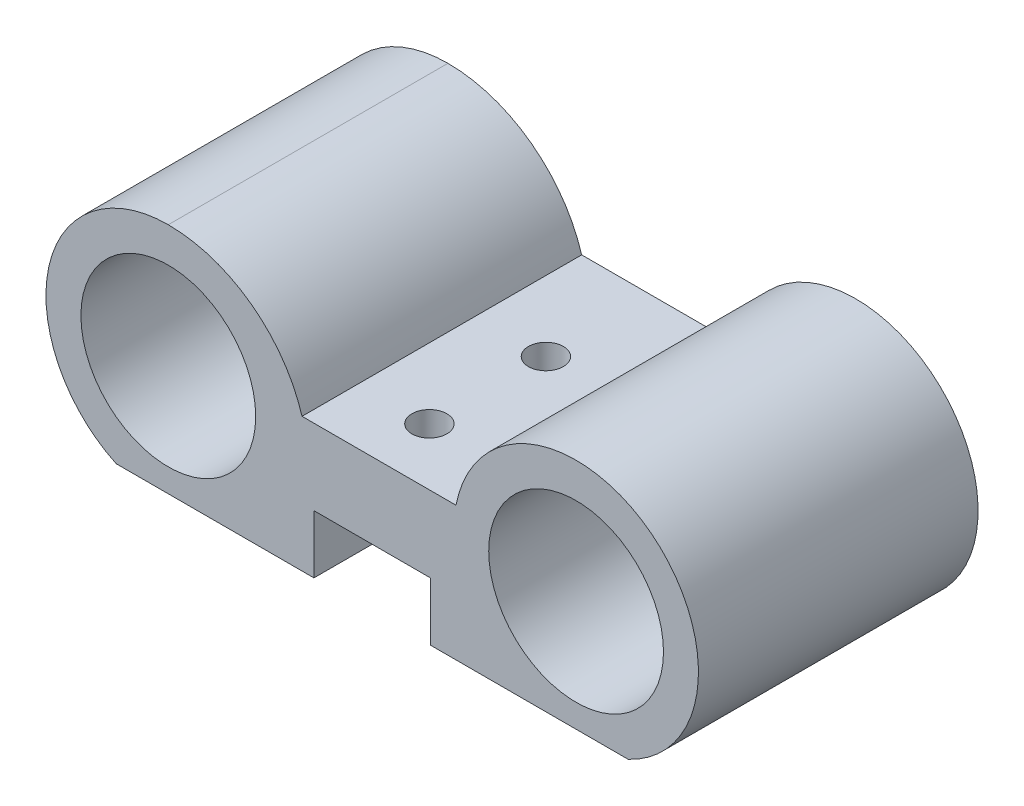
from build123d import *

# Parameters (mm, degrees)
SKETCH2_R               = 7.5
BOSS_EXTRUDE1_DEPTH     = 24
SKETCH4_R               = 1.5
CUT_EXTRUDE1_DEPTH      = 10
CUT_EXTRUDE2_DEPTH      = 40.812058475
CUT_EXTRUDE2_DEPTH_BACK = 40.812058475
SKETCH5_W               = 68.617197106
SKETCH5_H               = 1


with BuildPart() as part:
    # Sketch2 → Boss-Extrude1 (new body)
    with BuildSketch(Plane.XY):
        with BuildLine():
            Line((-17.5, -6), (-5, -6))
            Line((-5, -6), (-5, 0))
            Line((-5, 0), (5, 0))
            Line((5, 0), (5, -6))
            Line((5, -6), (17.5, -6))
            ThreePointArc((17.5, -6), (28, 4.5), (17.5, 15))
            ThreePointArc((17.5, 15), (10.819805392, 12.600925873), (7.192235936, 6.5))
            Line((7.192235936, 6.5), (-4.5, 6.5))
            Line((-4.5, 6.5), (-6.021759717, 6.5))
            ThreePointArc((-6.021759717, 6.5), (-10.358571571, 12.643650761), (-17.5, 15))
            ThreePointArc((-17.5, 15), (-28, 4.5), (-17.5, -6))
        make_face()
        with Locations((-17.5, 4.5)):
            Circle(SKETCH2_R, mode=Mode.SUBTRACT)
        with Locations((17.5, 4.5)):
            Circle(SKETCH2_R, mode=Mode.SUBTRACT)
    extrude(amount=BOSS_EXTRUDE1_DEPTH)

    # Sketch4 → Cut-Extrude1 (cut)
    with BuildSketch(Plane.XZ):
        with Locations((0, 9.091048368)):
            Circle(SKETCH4_R)
        with Locations((0, 19.091048368)):
            Circle(SKETCH4_R)
    extrude(amount=-CUT_EXTRUDE1_DEPTH, mode=Mode.SUBTRACT)

    # Sketch5 → Cut-Extrude2 (cut, two sides: drawn at the far end of the back side and taken through both)
    with BuildSketch(Plane(origin=(0, 0, 0), x_dir=(-1, 0, 0), z_dir=(0, 0, -1)).offset(-CUT_EXTRUDE2_DEPTH_BACK)):
        with Locations((-5.849443293, -5.5)):
            Rectangle(SKETCH5_W, SKETCH5_H)
    extrude(amount=CUT_EXTRUDE2_DEPTH + CUT_EXTRUDE2_DEPTH_BACK, mode=Mode.SUBTRACT)


solid = part.part
